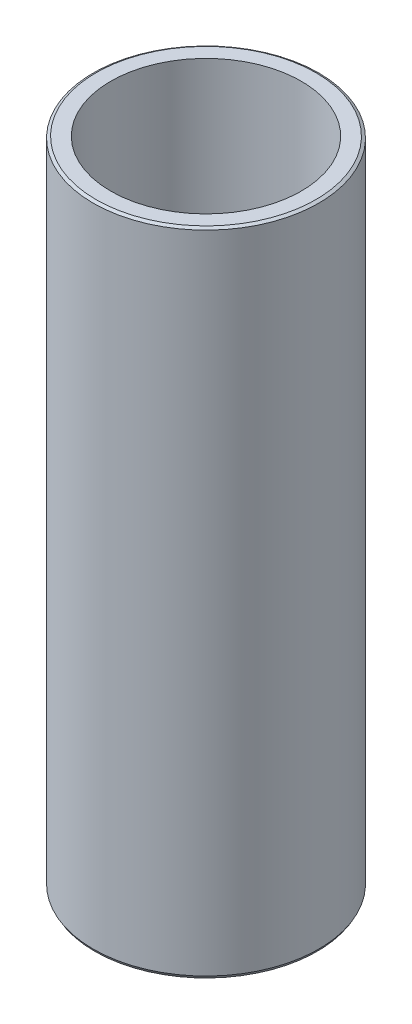
from build123d import *
from OCP.BRepFilletAPI import BRepFilletAPI_MakeChamfer

# Parameters (mm, degrees)
SKETCH1_R           = 37.5
BOSS_EXTRUDE1_DEPTH = 216.265143746
SKETCH2_R           = 31.672135115
CUT_EXTRUDE1_DEPTH  = 223.672657503
CHAMFER1_SIZE       = 0.547685284
CHAMFER1_SIZE2      = 0.948618738


with BuildPart() as part:
    # Sketch1 → Boss-Extrude1 (new body)
    with BuildSketch(Plane(origin=(0, 0, 0), x_dir=(1, 0, 0), z_dir=(0, 1, 0))):
        Circle(SKETCH1_R)
    extrude(amount=BOSS_EXTRUDE1_DEPTH)

    # Sketch2 → Cut-Extrude1 (cut, through all)
    with BuildSketch(Plane(origin=(0, 0, 0), x_dir=(1, 0, 0), z_dir=(0, 1, 0))):
        Circle(SKETCH2_R)
    extrude(amount=CUT_EXTRUDE1_DEPTH, mode=Mode.SUBTRACT)

    # Chamfer1: one chamfer whose edges measure the first distance from different faces: ONE call of the kernel's chamfer builder (chamfer() names one face for all edges)
    chamfer1_edges_1 = [part.edges().sort_by_distance(p)[0] for p in [
        (-37.5, 216.265143746, 0),
    ]]
    chamfer1_side_1 = [part.faces().sort_by_distance(p)[0] for p in [
        (-37.5, 108.132571873, 0),
    ]]
    chamfer1_edges_2 = [part.edges().sort_by_distance(p)[0] for p in [
        (-37.5, 0, 0),
    ]]
    chamfer1_side_2 = [part.faces().sort_by_distance(p)[0] for p in [
        (-36.439339828, 0, 0),
    ]]
    chamfer1 = BRepFilletAPI_MakeChamfer(part.part.solid().wrapped)
    for e in chamfer1_edges_1:
        chamfer1.Add(CHAMFER1_SIZE, CHAMFER1_SIZE2, e.wrapped, chamfer1_side_1[0].wrapped)  # the first distance lies on this face
    for e in chamfer1_edges_2:
        chamfer1.Add(CHAMFER1_SIZE, CHAMFER1_SIZE2, e.wrapped, chamfer1_side_2[0].wrapped)  # the first distance lies on this face
    add(Compound.cast(chamfer1.Shape()), mode=Mode.REPLACE)


solid = part.part
